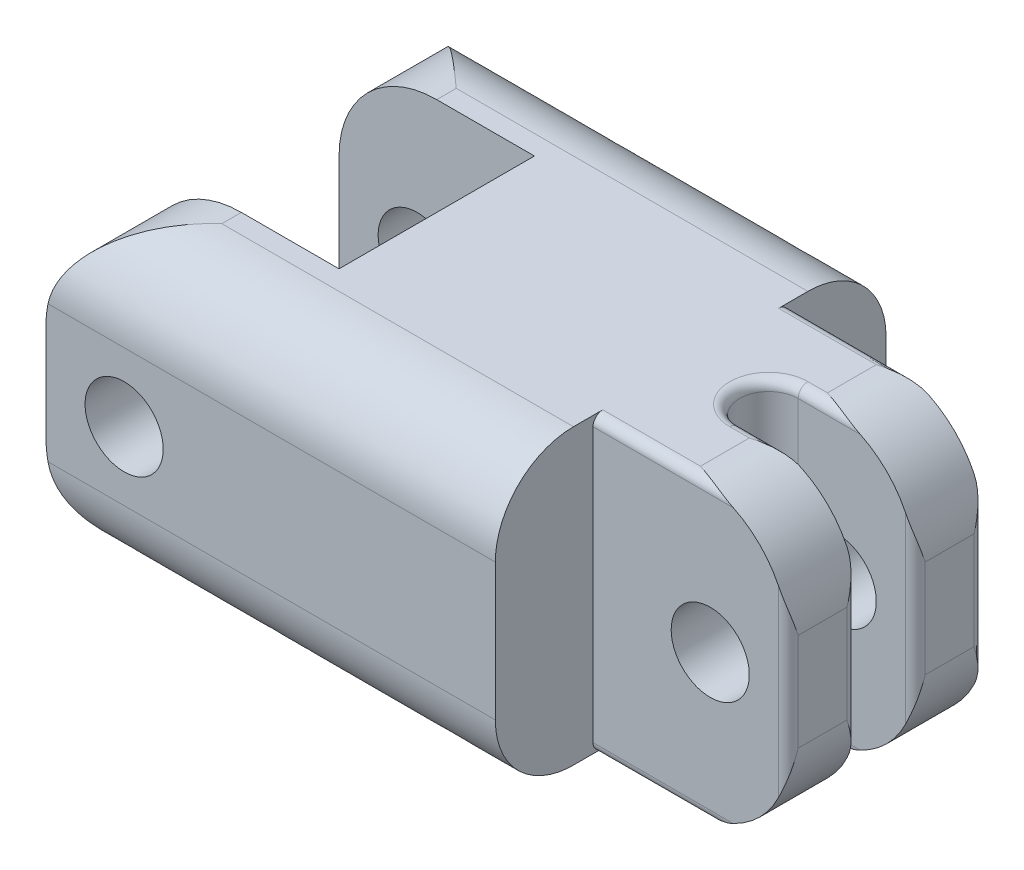
from build123d import *

# Parameters (mm, degrees)
BOSS_EXTRUDE1_DEPTH      = 20
BOSS_EXTRUDE1_DEPTH_BACK = 13
SKETCH1_W                = 20
SKETCH1_H                = 15
SKETCH2_W                = 10
SKETCH2_H                = 10
CUT_EXTRUDE1_DEPTH       = 19
VARFILLET1_R             = 4
VARFILLET2_R             = 4
CUT_EXTRUDE3_DEPTH       = 11
CUT_EXTRUDE3_DEPTH_BACK  = 11
SKETCH4_R                = 2
SKETCH5_W                = 10
SKETCH5_H                = 5
CUT_EXTRUDE4_DEPTH       = 19
FILLET1_R                = 0.5
CUT_EXTRUDE5_DEPTH       = 19
CUT_EXTRUDE5_DEPTH_BACK  = 19
SKETCH6_R                = 2
CUT_EXTRUDE6_DEPTH       = 19
CUT_EXTRUDE6_DEPTH_BACK  = 19


with BuildPart() as part:
    # Sketch1 → Boss-Extrude1 (new, two sides: drawn at the far end of the back side and taken through both)
    with BuildSketch(Plane(origin=(0, 0, 0), x_dir=(0, 0, -1), z_dir=(1, 0, 0)).offset(-BOSS_EXTRUDE1_DEPTH_BACK)):
        Rectangle(SKETCH1_W, SKETCH1_H)
    extrude(amount=BOSS_EXTRUDE1_DEPTH + BOSS_EXTRUDE1_DEPTH_BACK)

    # Sketch2 → Cut-Extrude1 (cut)
    with BuildSketch(Plane(origin=(0, 7.5, 0), x_dir=(1, 0, 0), z_dir=(0, 1, 0))):
        with Locations((-8, 0)):
            Rectangle(SKETCH2_W, SKETCH2_H)
    extrude(amount=-CUT_EXTRUDE1_DEPTH, mode=Mode.SUBTRACT)

    # VarFillet1
    varfillet1_edges = [part.edges().sort_by_distance(p)[0] for p in [
        (3.5, 7.5, -10),
        (3.5, 7.5, 10),
    ]]
    fillet(varfillet1_edges, radius=VARFILLET1_R)

    # VarFillet2
    varfillet2_edges = [part.edges().sort_by_distance(p)[0] for p in [
        (3.5, -7.5, 10),
        (3.5, -7.5, -10),
    ]]
    fillet(varfillet2_edges, radius=VARFILLET2_R)

    # Sketch4 → Cut-Extrude3 (cut, two sides: drawn at the far end of the back side and taken through both)
    with BuildSketch(Plane.XY.offset(-CUT_EXTRUDE3_DEPTH_BACK)):
        with Locations((-9, 0)):
            Circle(SKETCH4_R)
    extrude(amount=CUT_EXTRUDE3_DEPTH + CUT_EXTRUDE3_DEPTH_BACK, mode=Mode.SUBTRACT)

    # Sketch5 → Cut-Extrude4 (cut)
    with BuildSketch(Plane(origin=(0, 7.5, 0), x_dir=(1, 0, 0), z_dir=(0, 1, 0))):
        with Locations((15, 7.5)):
            Rectangle(SKETCH5_W, SKETCH5_H)
        with BuildLine():
            Line((20, 1.5), (14, 1.5))
            ThreePointArc((14, 1.5), (12.5, 0), (14, -1.5))
            Line((14, -1.5), (20, -1.5))
            Line((20, -1.5), (20, 1.5))
        make_face()
        with Locations((15, -7.5)):
            Rectangle(SKETCH5_W, SKETCH5_H)
    extrude(amount=-CUT_EXTRUDE4_DEPTH, mode=Mode.SUBTRACT)

    # Fillet1
    fillet1_edges = [part.edges().sort_by_distance(p)[0] for p in [
        (17, 7.5, -1.5),
        (17, 7.5, 1.5),
        (17, -7.5, 1.5),
        (17, -7.5, -1.5),
        (20, 0, 5),
        (20, 7.5, 3.25),
        (20, 0, 1.5),
        (20, -7.5, 3.25),
        (12.5, 7.5, 0),
        (12.5, -7.5, 0),
        (20, 0, -1.5),
        (20, 7.5, -3.25),
        (20, 0, -5),
        (20, -7.5, -3.25),
        (15, -7.5, -5),
        (15, -7.5, 5),
        (15, 7.5, -5),
        (15, 7.5, 5),
    ]]
    fillet(fillet1_edges, radius=FILLET1_R)

    # Sketch6 → Cut-Extrude5 (cut, two sides: drawn at the far end of the back side and taken through both)
    with BuildSketch(Plane.XY.offset(-CUT_EXTRUDE5_DEPTH_BACK)):
        with Locations((16, 0)):
            Circle(SKETCH6_R)
    extrude(amount=CUT_EXTRUDE5_DEPTH + CUT_EXTRUDE5_DEPTH_BACK, mode=Mode.SUBTRACT)

    # Sketch7 → Cut-Extrude6 (cut, two sides: drawn at the far end of the back side and taken through both)
    with BuildSketch(Plane.XY.offset(-CUT_EXTRUDE6_DEPTH_BACK)):
        with BuildLine():
            Line((-8, 7.5), (-13, 7.5))
            Line((-13, 7.5), (-13, 2.5))
            ThreePointArc((-13, 2.5), (-11.535533906, 6.035533906), (-8, 7.5))
        make_face()
        with BuildLine():
            Line((-13, -7.5), (-13, -2.5))
            ThreePointArc((-13, -2.5), (-11.535533906, -6.035533906), (-8, -7.5))
            Line((-8, -7.5), (-13, -7.5))
        make_face()
        with BuildLine():
            Line((15, 7.5), (20, 7.5))
            Line((20, 7.5), (20, 2.5))
            ThreePointArc((20, 2.5), (18.535533906, 6.035533906), (15, 7.5))
        make_face()
        with BuildLine():
            Line((20, -7.5), (20, -2.5))
            ThreePointArc((20, -2.5), (18.535533906, -6.035533906), (15, -7.5))
            Line((15, -7.5), (20, -7.5))
        make_face()
    extrude(amount=CUT_EXTRUDE6_DEPTH + CUT_EXTRUDE6_DEPTH_BACK, mode=Mode.SUBTRACT)


solid = part.part
